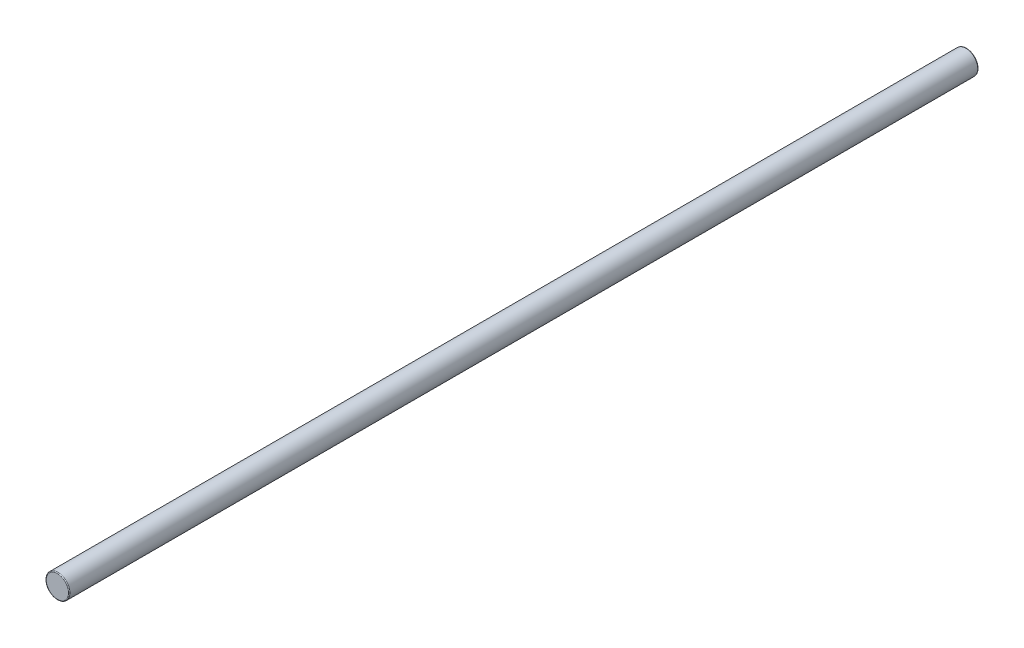
from build123d import *

# Parameters (mm, degrees)
SKETCH1_R           = 3
BOSS_EXTRUDE1_DEPTH = 230
FILLET1_R           = 0.2


with BuildPart() as part:
    # Sketch1 → Boss-Extrude1 (new body)
    with BuildSketch(Plane.XY):
        Circle(SKETCH1_R)
    extrude(amount=-BOSS_EXTRUDE1_DEPTH)

    # Fillet1
    fillet1_edges = [part.edges().sort_by_distance(p)[0] for p in [
        (-3, 0, -230),
        (-3, 0, 0),
    ]]
    fillet(fillet1_edges, radius=FILLET1_R)


solid = part.part
